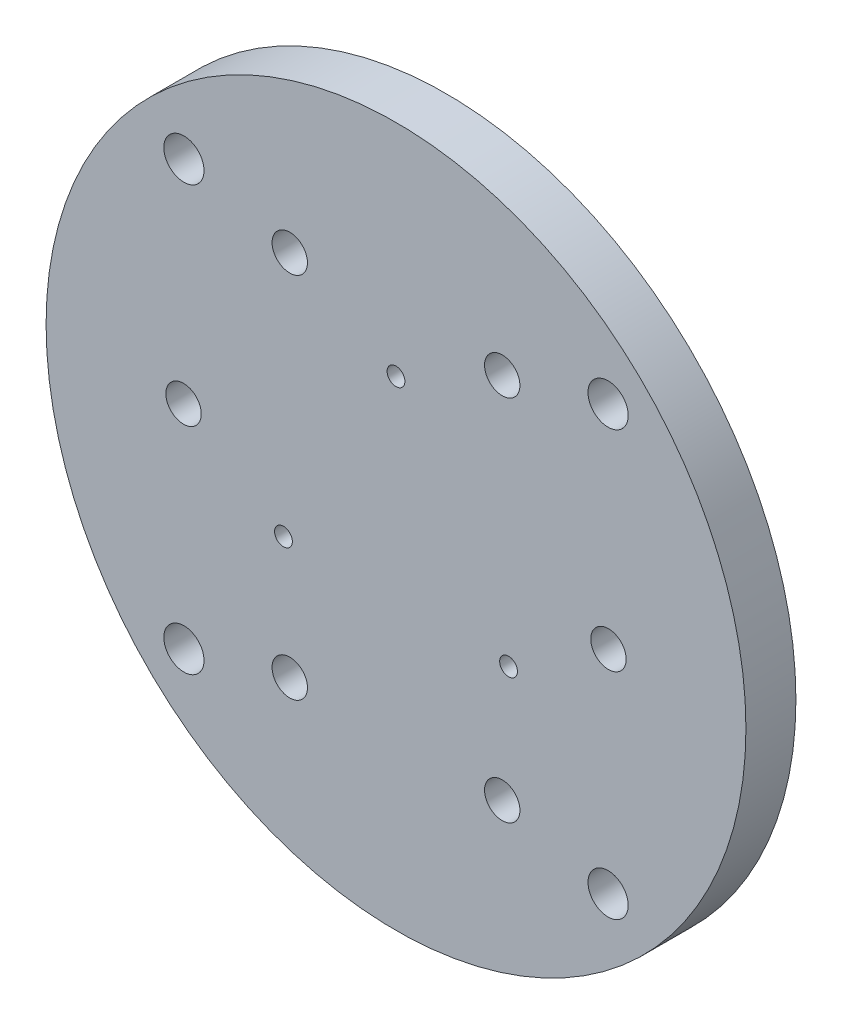
from build123d import *

# Parameters (mm, degrees)
SKETCH1_R                                      = 44.45
BOSS_EXTRUDE1_DEPTH                            = 6.35
CSK_FOR_8_FLAT_HEAD_MACHINE_SCREW1_D           = 4.4958
CSK_FOR_8_FLAT_HEAD_MACHINE_SCREW1_CSINK_D     = 9.7575878
CSK_FOR_8_FLAT_HEAD_MACHINE_SCREW1_CSINK_ANGLE = 82
CIRPATTERN1_COUNT                              = 6
F_10_CLEARANCE_HOLE1_D                         = 5.1054
CIRPATTERN2_COUNT                              = 4
F_4_40_TAPPED_HOLE1_D                          = 2.2606
CIRPATTERN3_COUNT                              = 3


with BuildPart() as part:
    # Sketch1 → Boss-Extrude1 (new body)
    with BuildSketch(Plane.XY):
        Circle(SKETCH1_R)
    extrude(amount=BOSS_EXTRUDE1_DEPTH)

    # CSK for #8 Flat Head Machine Screw1 (through all)
    with Locations(Plane(origin=(0, 0, 0), x_dir=(-1, 0, 0), z_dir=(0, 0, -1))):
        with Locations((-13.49375, 23.371860585)):
            csk_for_8_flat_head_machine_screw1 = CounterSinkHole(CSK_FOR_8_FLAT_HEAD_MACHINE_SCREW1_D / 2, CSK_FOR_8_FLAT_HEAD_MACHINE_SCREW1_CSINK_D / 2, counter_sink_angle=CSK_FOR_8_FLAT_HEAD_MACHINE_SCREW1_CSINK_ANGLE)

    # CirPattern1: CSK for #8 Flat Head Machine Screw1 ×6 about axis
    cirpattern1_axis = Axis((0, 0, 6.35), (0, 0, -1))
    for i in range(1, CIRPATTERN1_COUNT):
        add(csk_for_8_flat_head_machine_screw1.rotate(cirpattern1_axis, i * 360 / CIRPATTERN1_COUNT), mode=Mode.SUBTRACT)

    # #10 Clearance Hole1 (through all)
    with Locations(Plane.XY.offset(6.35)):
        with Locations((26.940768363, 26.940768363)):
            f_10_clearance_hole1 = Hole(F_10_CLEARANCE_HOLE1_D / 2)

    # CirPattern2: #10 Clearance Hole1 ×4 about axis
    cirpattern2_axis = Axis((0, 0, 6.35), (0, 0, -1))
    for i in range(1, CIRPATTERN2_COUNT):
        add(f_10_clearance_hole1.rotate(cirpattern2_axis, i * 360 / CIRPATTERN2_COUNT), mode=Mode.SUBTRACT)

    # #4-40 Tapped Hole1 (through all)
    with Locations(Plane.XY.offset(6.35)):
        with Locations((0, 16.51)):
            f_4_40_tapped_hole1 = Hole(F_4_40_TAPPED_HOLE1_D / 2)

    # CirPattern3: #4-40 Tapped Hole1 ×3 about axis
    cirpattern3_axis = Axis((0, 0, 6.35), (0, 0, -1))
    for i in range(1, CIRPATTERN3_COUNT):
        add(f_4_40_tapped_hole1.rotate(cirpattern3_axis, i * 360 / CIRPATTERN3_COUNT), mode=Mode.SUBTRACT)


solid = part.part
